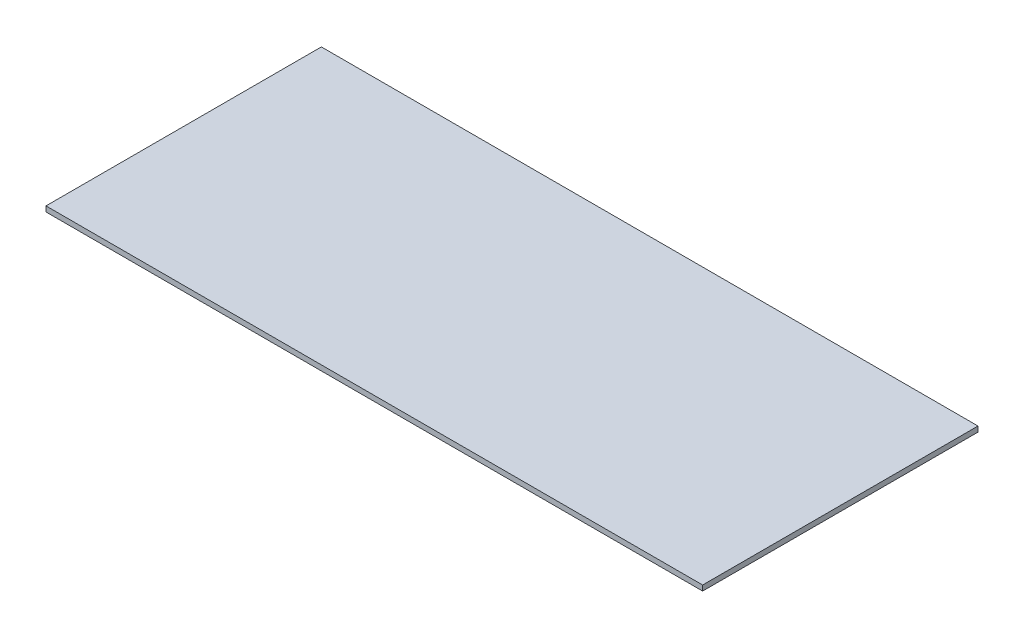
from build123d import *

# Parameters (mm, degrees)
SKETCH1_W           = 393.7
SKETCH1_H           = 165.1
BOSS_EXTRUDE1_DEPTH = 3.175


with BuildPart() as part:
    # Sketch1 → Boss-Extrude1 (new body)
    with BuildSketch(Plane(origin=(0, 0, 0), x_dir=(1, 0, 0), z_dir=(0, 1, 0))):
        Rectangle(SKETCH1_W, SKETCH1_H)
    extrude(amount=BOSS_EXTRUDE1_DEPTH)


solid = part.part
